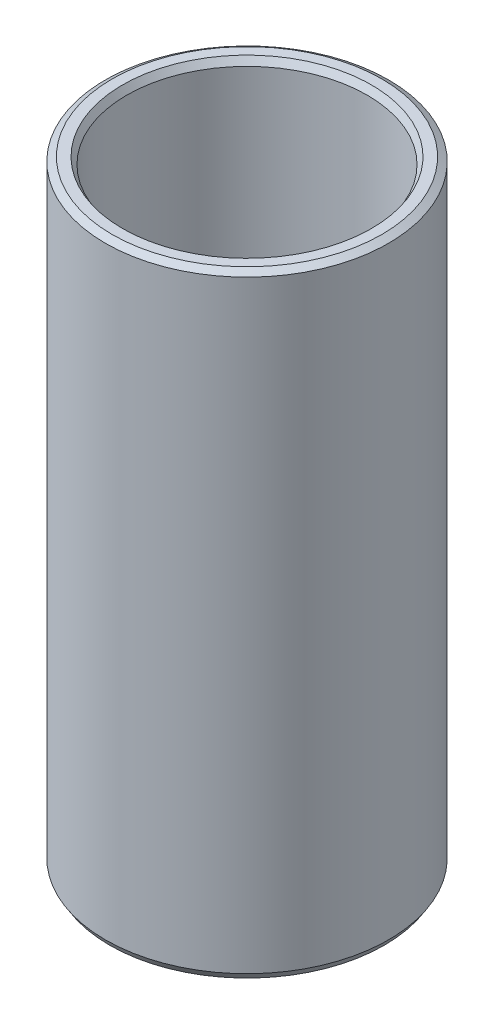
from build123d import *
from OCP.BRepFilletAPI import BRepFilletAPI_MakeChamfer

# Parameters (mm, degrees)
SKETCH1_R           = 22.5
BOSS_EXTRUDE1_DEPTH = 97.614415327
SKETCH2_R           = 19.110361451
CUT_EXTRUDE1_DEPTH  = 103.669733026
CHAMFER1_SIZE       = 0.66898801
CHAMFER1_SIZE2      = 1.077001578


with BuildPart() as part:
    # Sketch1 → Boss-Extrude1 (new body)
    with BuildSketch(Plane(origin=(0, 0, 0), x_dir=(1, 0, 0), z_dir=(0, 1, 0))):
        Circle(SKETCH1_R)
    extrude(amount=BOSS_EXTRUDE1_DEPTH)

    # Sketch2 → Cut-Extrude1 (cut, through all)
    with BuildSketch(Plane(origin=(0, 0, 0), x_dir=(1, 0, 0), z_dir=(0, 1, 0))):
        Circle(SKETCH2_R)
    extrude(amount=CUT_EXTRUDE1_DEPTH, mode=Mode.SUBTRACT)

    # Chamfer1: one chamfer whose edges measure the first distance from different faces: ONE call of the kernel's chamfer builder (chamfer() names one face for all edges)
    chamfer1_edges_1 = [part.edges().sort_by_distance(p)[0] for p in [
        (-19.110361451, 97.614415327, 0),
    ]]
    chamfer1_side_1 = [part.faces().sort_by_distance(p)[0] for p in [
        (-21.863603897, 97.614415327, 0),
    ]]
    chamfer1_edges_2 = [part.edges().sort_by_distance(p)[0] for p in [
        (-19.110361451, 0, 0),
    ]]
    chamfer1_side_2 = [part.faces().sort_by_distance(p)[0] for p in [
        (-19.110361451, 48.807207663, 0),
    ]]
    chamfer1_edges_3 = [part.edges().sort_by_distance(p)[0] for p in [
        (-22.5, 0, 0),
    ]]
    chamfer1_side_3 = [part.faces().sort_by_distance(p)[0] for p in [
        (-21.863603897, 0, 0),
    ]]
    chamfer1_edges_4 = [part.edges().sort_by_distance(p)[0] for p in [
        (-22.5, 97.614415327, 0),
    ]]
    chamfer1_side_4 = [part.faces().sort_by_distance(p)[0] for p in [
        (-22.5, 48.807207663, 0),
    ]]
    chamfer1 = BRepFilletAPI_MakeChamfer(part.part.solid().wrapped)
    for e in chamfer1_edges_1:
        chamfer1.Add(CHAMFER1_SIZE, CHAMFER1_SIZE2, e.wrapped, chamfer1_side_1[0].wrapped)  # the first distance lies on this face
    for e in chamfer1_edges_2:
        chamfer1.Add(CHAMFER1_SIZE, CHAMFER1_SIZE2, e.wrapped, chamfer1_side_2[0].wrapped)  # the first distance lies on this face
    for e in chamfer1_edges_3:
        chamfer1.Add(CHAMFER1_SIZE, CHAMFER1_SIZE2, e.wrapped, chamfer1_side_3[0].wrapped)  # the first distance lies on this face
    for e in chamfer1_edges_4:
        chamfer1.Add(CHAMFER1_SIZE, CHAMFER1_SIZE2, e.wrapped, chamfer1_side_4[0].wrapped)  # the first distance lies on this face
    add(Compound.cast(chamfer1.Shape()), mode=Mode.REPLACE)


solid = part.part
